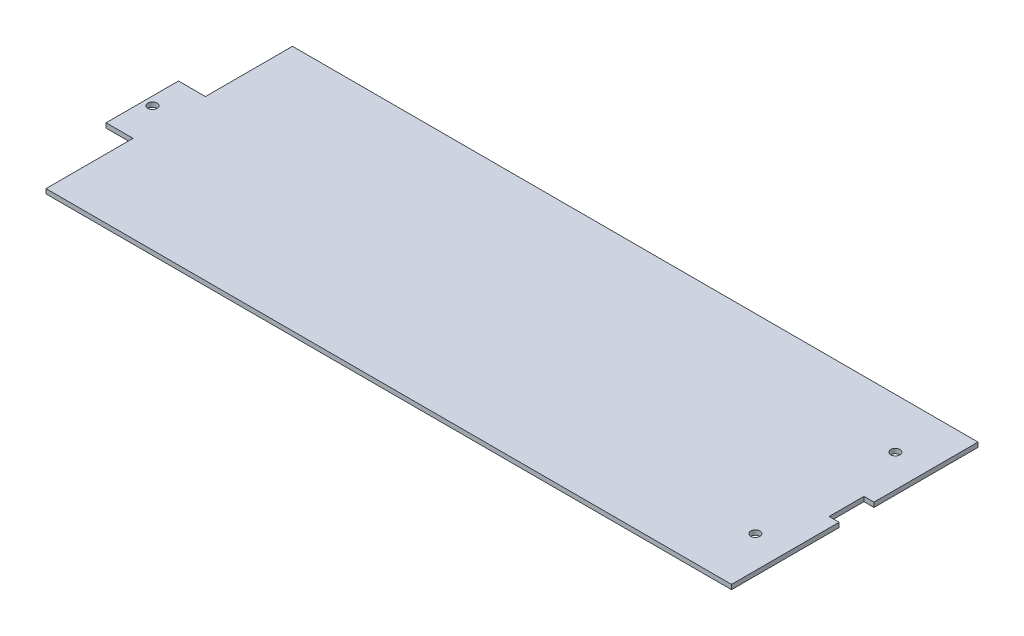
from build123d import *

# Parameters (mm, degrees)
BOSS_EXTRUDE1_START = 2
SKETCH1_R           = 3
BOSS_EXTRUDE1_DEPTH = 3


with BuildPart() as part:
    # Sketch1 → Boss-Extrude1 (new body)
    with BuildSketch(Plane(origin=(0, 0, 0), x_dir=(1, 0, 0), z_dir=(0, 1, 0)).offset(BOSS_EXTRUDE1_START)):
        Polygon((-284.735528935, -755.752958253), (-302.235528935, -755.752958253), (-302.235528935, -802.752958253), (-284.735528935, -802.752958253), (-284.735528935, -859.252958253), (160.264471065, -859.252958253), (160.264471065, -789.39086684), (153.764471065, -789.39086684), (153.764471065, -766.79086684), (160.264471065, -766.79086684), (160.264471065, -699.252958253), (-284.735528935, -699.252958253), align=None)
        with Locations((139.486711961, -823.034841982)):
            Circle(SKETCH1_R, mode=Mode.SUBTRACT)
        with Locations((-296.74646616, -778.09086684)):
            Circle(SKETCH1_R, mode=Mode.SUBTRACT)
        with Locations((139.102370463, -731.752958253)):
            Circle(SKETCH1_R, mode=Mode.SUBTRACT)
    extrude(amount=BOSS_EXTRUDE1_DEPTH)


solid = part.part
